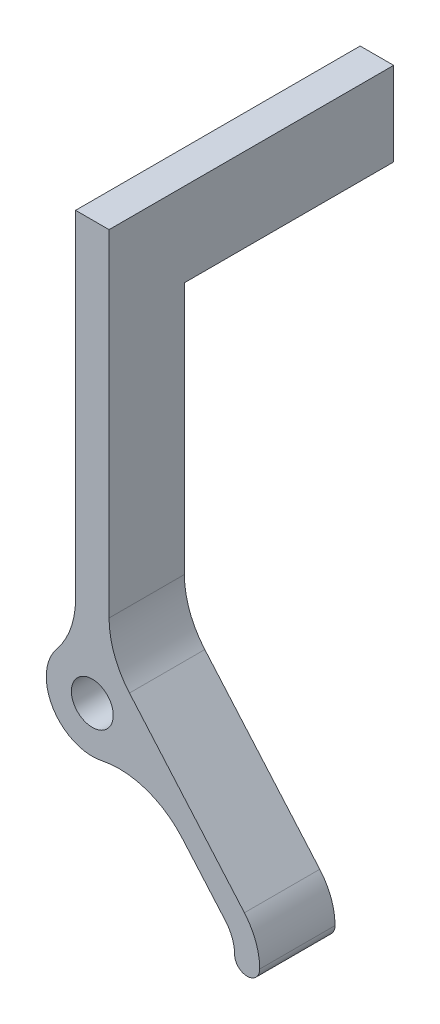
from build123d import *

# Parameters (mm, degrees)
SKETCH1_R           = 2.5
BOSS_EXTRUDE1_DEPTH = 9
FILLET1_R           = 10
SKETCH2_W           = 4
SKETCH2_H           = 10
BOSS_EXTRUDE2_DEPTH = 25


with BuildPart() as part:
    # Sketch1 → Boss-Extrude1 (new body)
    with BuildSketch(Plane.XY):
        with BuildLine():
            Line((4.158841106, 3.599172218), (18.171146962, -12.592037884))
            ThreePointArc((18.171146962, -12.592037884), (19.527930073, -14.881183685), (20, -17.5))
            ThreePointArc((20, -17.5), (18.5, -19), (17, -17.5))
            ThreePointArc((17, -17.5), (16.716758044, -15.928710211), (15.902688177, -14.55522273))
            Line((15.902688177, -14.55522273), (5.09624975, -2.068390312))
            ThreePointArc((5.09624975, -2.068390312), (-3.915025373, -3.862975062), (-2, 5.123475383))
            Line((-2, 5.123475383), (-2, 50))
            Line((-2, 50), (2, 50))
            Line((2, 50), (2, 5.123475383))
            ThreePointArc((2, 5.123475383), (3.172334468, 4.492915982), (4.158841106, 3.599172218))
        make_face()
        Circle(SKETCH1_R, mode=Mode.SUBTRACT)
    extrude(amount=BOSS_EXTRUDE1_DEPTH)

    # Fillet1
    fillet1_edges = [part.edges().sort_by_distance(p)[0] for p in [
        (5.09624975, -2.068390312, 4.5),
        (-2, 5.123475383, 4.5),
        (2, 5.123475383, 4.5),
    ]]
    fillet(fillet1_edges, radius=FILLET1_R)

    # Sketch2 → Boss-Extrude2 (add)
    with BuildSketch(Plane(origin=(0, 0, 0), x_dir=(-1, 0, 0), z_dir=(0, 0, -1))):
        with Locations((0, 45)):
            Rectangle(SKETCH2_W, SKETCH2_H)
    extrude(amount=BOSS_EXTRUDE2_DEPTH)


solid = part.part
